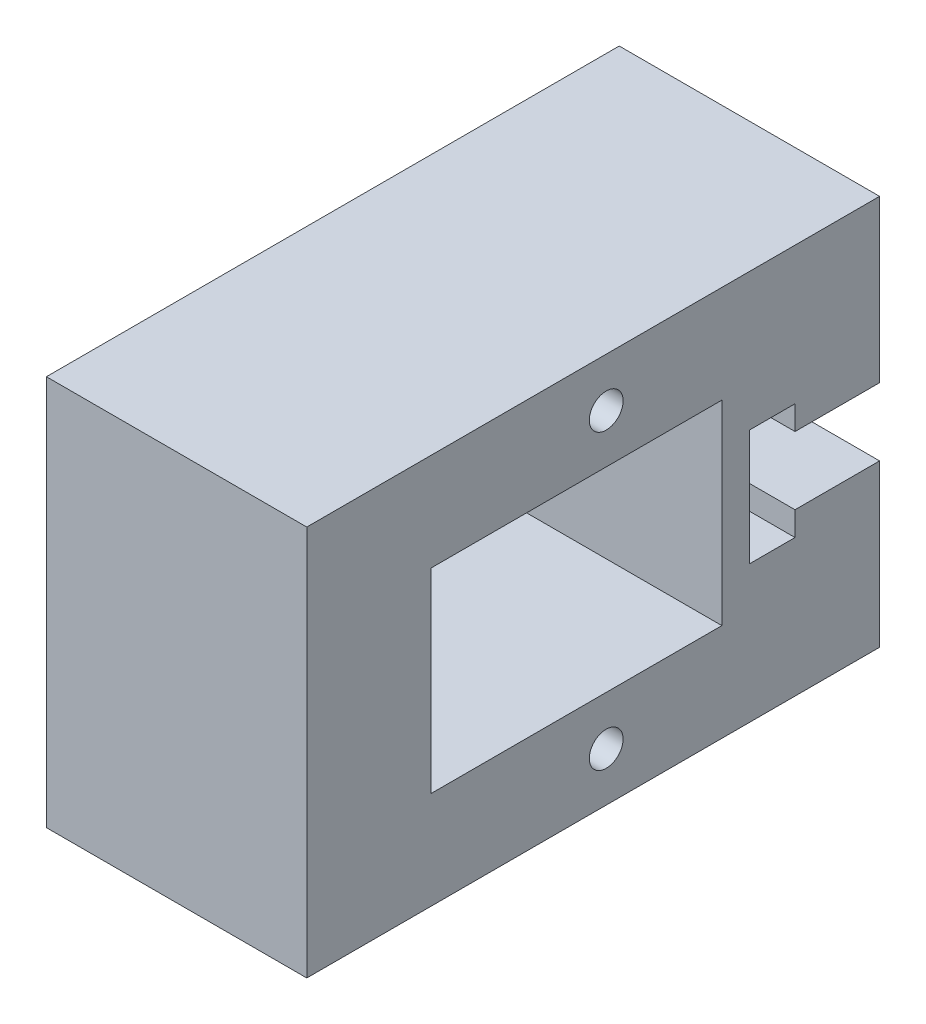
from build123d import *

# Parameters (mm, degrees)
SKETCH1_W                 = 38.1
SKETCH1_H                 = 50.8
BOSS_EXTRUDE1_DEPTH       = 25.4
CUT_EXTRUDE1_DEPTH        = 25.4
SKETCH3_W                 = 31.75
SKETCH3_H                 = 31.75
CUT_EXTRUDE2_DEPTH        = 21.59
SKETCH5_W                 = 12.7
SKETCH5_H                 = 12.7
CUT_EXTRUDE3_DEPTH        = 3.81
SKETCH4_W                 = 12.7
SKETCH4_H                 = 25.4
CUT_EXTRUDE4_DEPTH        = 3.175
SKETCH6_W                 = 6.35
SKETCH6_H                 = 5.08
SKETCH6_W_2               = 31.75
BOSS_EXTRUDE2_DEPTH       = 25.4
CUT_EXTRUDE5_START        = -25.4
SKETCH7_R                 = 1.7145
CUT_EXTRUDE5_DEPTH        = 25.4
SKETCH8_R                 = 3.175
CUT_EXTRUDE6_DEPTH        = 18.796
CUT_EXTRUDE7_START        = -25.4
SKETCH9_R                 = 3.175
CUT_EXTRUDE7_DEPTH        = 25.4
SKETCH10_R                = 4.826
SKETCH10_R_2              = 3.175
SKETCH10_R_3              = 4.7625
BOSS_EXTRUDE3_DEPTH       = 25.4
SKETCH11_R                = 3.175
BOSS_EXTRUDE4_DEPTH       = 25.4
SKETCH12_R                = 3.175
SKETCH12_R_2              = 1.651
BOSS_EXTRUDE5_DEPTH       = 5
BOSS_EXTRUDE6_DEPTH       = 25.4
BOSS_EXTRUDE7_DEPTH       = 25.4
SKETCH15_W                = 25.4
SKETCH15_H                = 38.1
BOSS_EXTRUDE8_DEPTH       = 5.08
CUT_EXTRUDE9_START        = -21.59
SKETCH16_W                = 9.228
SKETCH16_H                = 3.577281452
CUT_EXTRUDE9_DEPTH        = 21.59
FILLET1_R                 = 30.48
FILLET2_R                 = 2.54
CUT_EXTRUDE10_START       = -21.59
SKETCH17_W                = 31.75
SKETCH17_H                = 27.158947133
CUT_EXTRUDE10_DEPTH       = 21.59
CUT_EXTRUDE11_START       = -21.59
SKETCH18_W                = 31.75
SKETCH18_H                = 1.235371837
CUT_EXTRUDE11_DEPTH       = 21.59
SKETCH19_W                = 5.08
SKETCH19_H                = 28.39431897
BOSS_EXTRUDE9_DEPTH       = 21.59
SKETCH20_R                = 1.651
CUT_EXTRUDE12_DEPTH       = 25.4
BOSS_EXTRUDE10_START      = -3.81
BOSS_EXTRUDE10_DEPTH      = 3.81
SKETCH23_W                = 21.59
SKETCH23_H                = 13.188947133
CUT_EXTRUDE13_DEPTH       = 3.81
BOSS_EXTRUDE13_DEPTH      = 21.59
BOSS_EXTRUDE13_DEPTH_BACK = 3.81
SKETCH24_W                = 1.27
SKETCH24_H                = 28.39431897
SKETCH25_W                = 12.7
SKETCH25_H                = 2.686052867
BOSS_EXTRUDE14_DEPTH      = 31.75


with BuildPart() as part:
    # Sketch1 → Boss-Extrude1 (new body)
    with BuildSketch(Plane.YZ):
        with Locations((19.05, 25.4)):
            Rectangle(SKETCH1_W, SKETCH1_H)
    extrude(amount=BOSS_EXTRUDE1_DEPTH)

    # Sketch2 → Cut-Extrude1 (cut)
    with BuildSketch(Plane.YZ.offset(25.4)):
        Polygon((13.3985, 12.7), (24.7015, 12.7), (24.7015, 8.250084788), (22.352, 8.250084788), (22.352, 0), (15.748, 0), (15.748, 8.250084788), (13.3985, 8.250084788), align=None)
    extrude(amount=-CUT_EXTRUDE1_DEPTH, mode=Mode.SUBTRACT)

    # Sketch3 → Cut-Extrude2 (cut)
    with BuildSketch(Plane.YZ.offset(25.4)):
        with Locations((19.05, 31.75)):
            Rectangle(SKETCH3_W, SKETCH3_H)
    extrude(amount=-CUT_EXTRUDE2_DEPTH, mode=Mode.SUBTRACT)

    # Sketch5 → Cut-Extrude3 (cut)
    with BuildSketch(Plane(origin=(0, 0, 0), x_dir=(0, -1, 0), z_dir=(-1, 0, 0))):
        with Locations((-12.7, 22.225)):
            Rectangle(SKETCH5_W, SKETCH5_H)
    extrude(amount=-CUT_EXTRUDE3_DEPTH, mode=Mode.SUBTRACT)

    # Sketch4 → Cut-Extrude4 (cut)
    with BuildSketch(Plane.XY.offset(15.875)):
        with Locations((10.16, 19.05)):
            Rectangle(SKETCH4_W, SKETCH4_H)
    extrude(amount=-CUT_EXTRUDE4_DEPTH, mode=Mode.SUBTRACT)

    # Sketch6 → Boss-Extrude2 (add)
    with BuildSketch(Plane.YZ.offset(25.4)):
        with Locations((6.35, 18.415)):
            Rectangle(SKETCH6_W, SKETCH6_H)
        with Locations((31.75, 18.415)):
            Rectangle(SKETCH6_W, SKETCH6_H)
        with Locations((19.05, 45.085)):
            Rectangle(SKETCH6_W_2, SKETCH6_H)
    extrude(amount=-BOSS_EXTRUDE2_DEPTH)

    # Sketch7 → Cut-Extrude5 (cut)
    with BuildSketch(Plane(origin=(0, 0, 0), x_dir=(0, -1, 0), z_dir=(-1, 0, 0)).offset(CUT_EXTRUDE5_START)):
        with Locations(Location((-20.066, 46.303766696, 0), (0, 0, 90))):
            Circle(SKETCH7_R)
        with Locations(Location((-5.334, 46.303766696, 0), (0, 0, 90))):
            Circle(SKETCH7_R)
        with Locations(Location((-4.496233304, 16.002, 0), (0, 0, 90))):
            Circle(SKETCH7_R)
        with Locations(Location((-20.903766696, 16.002, 0), (0, 0, 90))):
            Circle(SKETCH7_R)
    extrude(amount=CUT_EXTRUDE5_DEPTH, mode=Mode.SUBTRACT)

    # Sketch8 → Cut-Extrude6 (cut)
    with BuildSketch(Plane(origin=(0, 0, 0), x_dir=(0, -1, 0), z_dir=(-1, 0, 0))):
        with Locations(Location((-20.066, 46.303766696, 0), (0, 0, 90))):
            Circle(SKETCH8_R)
        with Locations(Location((-5.334, 46.303766696, 0), (0, 0, 90))):
            Circle(SKETCH8_R)
        with Locations(Location((-4.496233304, 16.002, 0), (0, 0, 90))):
            Circle(SKETCH8_R)
        with Locations((-20.903766696, 16.002)):
            Circle(SKETCH8_R)
    extrude(amount=-CUT_EXTRUDE6_DEPTH, mode=Mode.SUBTRACT)

    # Sketch9 → Cut-Extrude7 (cut)
    with BuildSketch(Plane(origin=(0, 0, 0), x_dir=(0, -1, 0), z_dir=(-1, 0, 0)).offset(CUT_EXTRUDE7_START)):
        with Locations(Location((-20.066, 37.819300087, 0), (0, 0, 90))):
            Circle(SKETCH9_R)
        with Locations((-5.334, 24.054233304)):
            Circle(SKETCH9_R)
    extrude(amount=CUT_EXTRUDE7_DEPTH, mode=Mode.SUBTRACT)

    # Sketch10 → Boss-Extrude3 (add)
    # profile 1 of 2: a face of its own
    with BuildSketch(Plane.YZ.offset(25.4)):
        with Locations((5.334, 24.054233304)):
            Circle(SKETCH10_R)
        with Locations(Location((5.334, 24.054233304, 0), (0, 0, 90))):
            Circle(SKETCH10_R_2, mode=Mode.SUBTRACT)
    # profile 2 of 2: a face of its own
    with BuildSketch(Plane.YZ.offset(25.4)):
        with Locations((20.066, 37.819300087)):
            Circle(SKETCH10_R_3)
        with Locations(Location((20.066, 37.819300087, 0), (0, 0, 90))):
            Circle(SKETCH10_R_2, mode=Mode.SUBTRACT)
    extrude(amount=-BOSS_EXTRUDE3_DEPTH)

    # Sketch11 → Boss-Extrude4 (add)
    with BuildSketch(Plane(origin=(0, 0, 0), x_dir=(0, -1, 0), z_dir=(-1, 0, 0))):
        with Locations(Location((-20.903766696, 16.002, 0), (0, 0, 357.707557224))):
            Circle(SKETCH11_R)
        with Locations((-4.496233304, 16.002)):
            Circle(SKETCH11_R)
        with Locations((-20.066, 46.303766696)):
            Circle(SKETCH11_R)
        with Locations((-5.334, 46.303766696)):
            Circle(SKETCH11_R)
    extrude(amount=-BOSS_EXTRUDE4_DEPTH)

    # Sketch12 → Boss-Extrude5 (add)
    # profile 1 of 2: a face of its own
    with BuildSketch(Plane.YZ.offset(25.4)):
        with Locations(Location((5.334, 24.054233304, 0), (0, 0, 90))):
            Circle(SKETCH12_R)
        with Locations(Location((5.334, 24.054233304, 0), (0, 0, 270))):
            Circle(SKETCH12_R_2, mode=Mode.SUBTRACT)
    # profile 2 of 2: a face of its own
    with BuildSketch(Plane.YZ.offset(25.4)):
        with Locations(Location((20.066, 37.819300087, 0), (0, 0, 90))):
            Circle(SKETCH12_R)
        with Locations(Location((20.066, 37.819300087, 0), (0, 0, 270))):
            Circle(SKETCH12_R_2, mode=Mode.SUBTRACT)
    extrude(amount=-BOSS_EXTRUDE5_DEPTH)

    # Sketch13 → Boss-Extrude6 (add)
    with BuildSketch(Plane.YZ.offset(25.4)):
        with BuildLine():
            Line((22.225, 42.064311895), (22.225, 42.545))
            Line((22.225, 42.545), (20.656903194, 42.545))
            ThreePointArc((20.656903194, 42.545), (21.461799827, 42.372666874), (22.225, 42.064311895))
        make_face()
    extrude(amount=-BOSS_EXTRUDE6_DEPTH)

    # Sketch14 → Boss-Extrude7 (add)
    with BuildSketch(Plane.YZ.offset(25.4)):
        with BuildLine():
            Line((19.475096806, 42.545), (15.3035, 42.545))
            Line((15.3035, 42.545), (15.3035, 37.819300087))
            ThreePointArc((15.3035, 37.819300087), (16.495595071, 40.971063862), (19.475096806, 42.545))
        make_face()
    extrude(amount=-BOSS_EXTRUDE7_DEPTH)

    # Sketch15 → Boss-Extrude8 (add)
    with BuildSketch(Plane.XY.offset(50.8)):
        with Locations((12.7, 19.05)):
            Rectangle(SKETCH15_W, SKETCH15_H)
    extrude(amount=BOSS_EXTRUDE8_DEPTH)

    # Sketch16 → Cut-Extrude9 (cut)
    with BuildSketch(Plane.YZ.offset(25.4).offset(CUT_EXTRUDE9_START)):
        with Locations((12.700000043, 41.880359274)):
            Rectangle(SKETCH16_W, SKETCH16_H)
    extrude(amount=CUT_EXTRUDE9_DEPTH, mode=Mode.SUBTRACT)

    # Fillet1
    # the kernel refuses this fillet: 30.48 mm, written as the material it takes off along each edge
    with BuildSketch(Plane(origin=(3.81, 15.3035, 40.091718548), x_dir=(0, 0, -1), z_dir=(1, 0, 0))) as fillet1_piece_1:
        with BuildLine():
            CenterArc((10.886595988, 30.48), FILLET1_R, 249.07339313, 20.92660687)
            Line((0, 2.010500043), (0, 0))
            Line((0, 0), (10.886595988, 0))
        make_face()
    extrude(amount=48.806489969, mode=Mode.SUBTRACT)

    # Fillet2
    fillet2_edges = [part.edges().sort_by_distance(p)[0] for p in [
        (14.605, 15.945995831, 35.430373154),
    ]]
    fillet(fillet2_edges, radius=FILLET2_R)

    # Sketch17 → Cut-Extrude10 (cut)
    with BuildSketch(Plane.YZ.offset(25.4).offset(CUT_EXTRUDE10_START)):
        with Locations((19.05, 28.965526434)):
            Rectangle(SKETCH17_W, SKETCH17_H)
    extrude(amount=CUT_EXTRUDE10_DEPTH, mode=Mode.SUBTRACT)

    # Sketch18 → Cut-Extrude11 (cut)
    with BuildSketch(Plane.YZ.offset(25.4).offset(CUT_EXTRUDE11_START)):
        with Locations((19.05, 43.162685919)):
            Rectangle(SKETCH18_W, SKETCH18_H)
    extrude(amount=CUT_EXTRUDE11_DEPTH, mode=Mode.SUBTRACT)

    # Sketch19 → Boss-Extrude9 (add)
    with BuildSketch(Plane.YZ.offset(3.81)):
        with Locations((5.715, 29.583212352)):
            Rectangle(SKETCH19_W, SKETCH19_H)
        with Locations((32.385, 29.583212352)):
            Rectangle(SKETCH19_W, SKETCH19_H)
    extrude(amount=BOSS_EXTRUDE9_DEPTH)

    # Sketch20 → Cut-Extrude12 (cut)
    with BuildSketch(Plane.YZ.offset(25.4)):
        with Locations(Location((4.7625, 26.67, 0), (0, 0, 270))):
            Circle(SKETCH20_R)
        with Locations(Location((33.3375, 26.67, 0), (0, 0, 270))):
            Circle(SKETCH20_R)
    extrude(amount=-CUT_EXTRUDE12_DEPTH, mode=Mode.SUBTRACT)

    # Sketch22 → Boss-Extrude10 (add)
    with BuildSketch(Plane(origin=(0, 0, 0), x_dir=(0, -1, 0), z_dir=(-1, 0, 0)).offset(BOSS_EXTRUDE10_START)):
        with BuildLine():
            Line((-7.023066157, 28.575), (-8.255, 28.575))
            Line((-8.255, 28.575), (-8.255, 27.895852104))
            ThreePointArc((-8.255, 27.895852104), (-7.663911578, 28.280554168), (-7.023066157, 28.575))
        make_face()
        with BuildLine():
            ThreePointArc((-6.367681938, 27.056253732), (-5.182460289, 25.073305178), (-3.175, 26.216519295))
            ThreePointArc((-3.175, 26.216519295), (-3.157324346, 26.283720153), (-3.142492042, 26.351605253))
            ThreePointArc((-3.142492042, 26.351605253), (-6.011696572, 20.952402819), (-6.367681938, 27.056253732))
        make_face()
    extrude(amount=BOSS_EXTRUDE10_DEPTH)

    # Sketch23 → Cut-Extrude13 (cut)
    with BuildSketch(Plane.YZ.offset(3.81)):
        with Locations((19.05, 21.980526434)):
            Rectangle(SKETCH23_W, SKETCH23_H)
    extrude(amount=-CUT_EXTRUDE13_DEPTH, mode=Mode.SUBTRACT)

    # Sketch24 → Boss-Extrude13 (add, two sides: drawn at the far end of the back side and taken through both)
    with BuildSketch(Plane.YZ.offset(3.81).offset(-BOSS_EXTRUDE13_DEPTH_BACK)):
        with Locations((29.21, 29.583212352)):
            Rectangle(SKETCH24_W, SKETCH24_H)
        with Locations((8.89, 29.583212352)):
            Rectangle(SKETCH24_W, SKETCH24_H)
    extrude(amount=BOSS_EXTRUDE13_DEPTH + BOSS_EXTRUDE13_DEPTH_BACK)

    # Sketch25 → Boss-Extrude14 (add)
    with BuildSketch(Plane.XZ.offset(-31.75)):
        with Locations((10.16, 14.043026433)):
            Rectangle(SKETCH25_W, SKETCH25_H)
    extrude(amount=BOSS_EXTRUDE14_DEPTH)


solid = part.part
